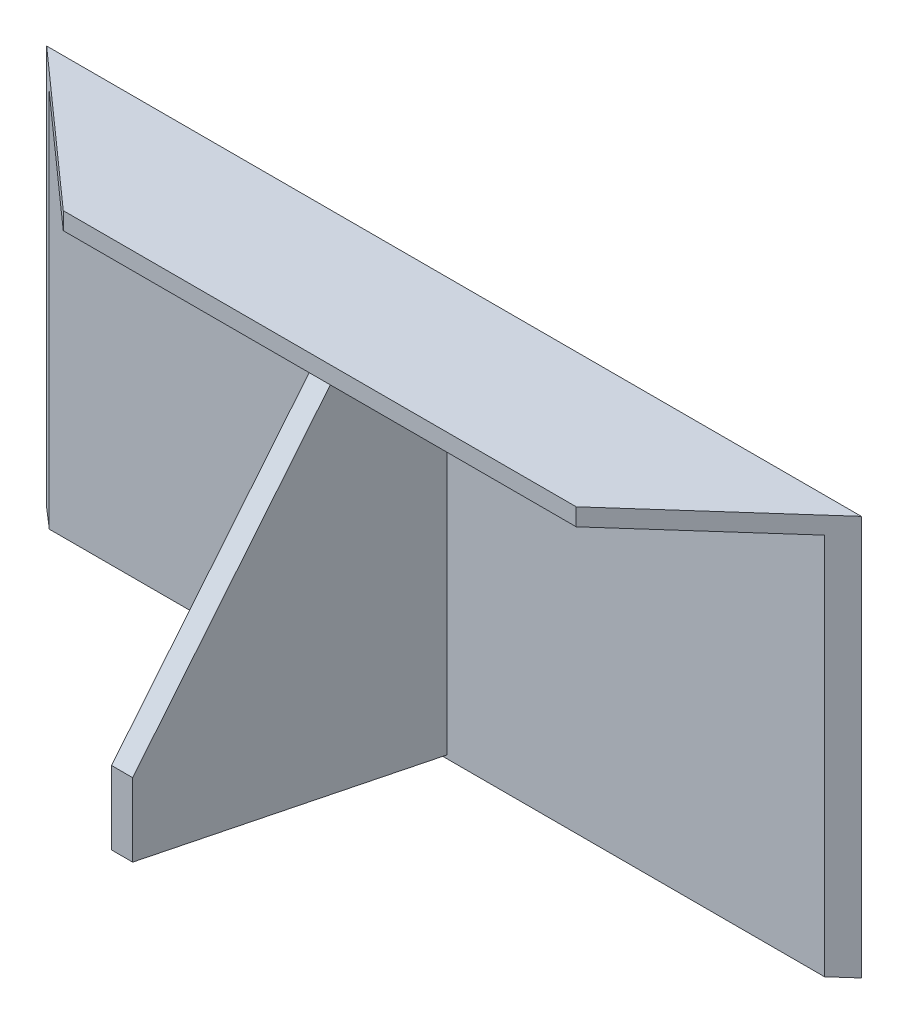
from build123d import *

# Parameters (mm, degrees)
SKETCH_1_W          = 540
SKETCH_1_H          = 265
SKETCH_1_R          = 13
EXTRUDE_635_DEPTH   = 11.5
SKETCH_2_W          = 540
SKETCH_2_H          = 11.5
EXTRUDE_1_DEPTH     = 77.5
CUT_EXTRUDE_1_DEPTH = 609.067430471
SKETCH_4_R          = 13
CUT_EXTRUDE_2_DEPTH = 609.067430471
SKETCH_5_W          = 14
SKETCH_5_H          = 253.5
EXTRUDE_2_DEPTH     = 208.5
SKETCH_6_R          = 13
CUT_EXTRUDE_3_DEPTH = 442.988687638
EXTRUDE_3_DEPTH     = 14
SKETCH_8_W          = 514.15730337
SKETCH_8_H          = 253.5
EXTRUDE_4_DEPTH     = 11.5
EXTRUDE_5_DEPTH     = 11.5


with BuildPart() as part:
    # 草图1 → Extrude 635 (new body)
    with BuildSketch(Plane.XY):
        with Locations((270, 132.5)):
            Rectangle(SKETCH_1_W, SKETCH_1_H)
        with Locations((97.46594539, 108.46594539)):
            Circle(SKETCH_1_R, mode=Mode.SUBTRACT)
        with Locations((40.897402896, 51.897402896)):
            Circle(SKETCH_1_R, mode=Mode.SUBTRACT)
        with Locations((499.102597104, 51.897402896)):
            Circle(SKETCH_1_R, mode=Mode.SUBTRACT)
        with Locations((402.170987639, 92.261534081)):
            Circle(SKETCH_1_R, mode=Mode.SUBTRACT)
        with Locations((230, 121)):
            Circle(SKETCH_1_R, mode=Mode.SUBTRACT)
        with Locations((230, 41)):
            Circle(SKETCH_1_R, mode=Mode.SUBTRACT)
        with Locations((310, 41)):
            Circle(SKETCH_1_R, mode=Mode.SUBTRACT)
        with Locations((310, 121)):
            Circle(SKETCH_1_R, mode=Mode.SUBTRACT)
        with Locations((137.829012361, 92.261534081)):
            Circle(SKETCH_1_R, mode=Mode.SUBTRACT)
        with Locations((442.53405461, 108.46594539)):
            Circle(SKETCH_1_R, mode=Mode.SUBTRACT)
    extrude(amount=EXTRUDE_635_DEPTH)

    # 草图2 → 凸台-拉伸1 (add)
    with BuildSketch(Plane.XY.offset(11.5)):
        with Locations((270, 259.25)):
            Rectangle(SKETCH_2_W, SKETCH_2_H)
    extrude(amount=EXTRUDE_1_DEPTH)

    # 草图3 → 切除-拉伸1 (cut, through all)
    with BuildSketch(Plane(origin=(0, 265, 0), x_dir=(-1, 0, 0), z_dir=(0, 1, 0))):
        Polygon((0, 0), (-100, 89), (0, 89), align=None)
        Polygon((-540, 0), (-440, 89), (-540, 89), align=None)
    extrude(amount=-CUT_EXTRUDE_1_DEPTH, mode=Mode.SUBTRACT)

    # 草图4 → 切除-拉伸2 (cut, through all)
    with BuildSketch(Plane(origin=(0, 265, 0), x_dir=(-1, 0, 0), z_dir=(0, 1, 0))):
        with Locations((-210, 50)):
            Circle(SKETCH_4_R)
        with Locations((-130, 50)):
            Circle(SKETCH_4_R)
        with Locations((-410, 50)):
            Circle(SKETCH_4_R)
        with Locations((-330, 50)):
            Circle(SKETCH_4_R)
    extrude(amount=-CUT_EXTRUDE_2_DEPTH, mode=Mode.SUBTRACT)

    # 草图5 → 凸台-拉伸2 (add)
    with BuildSketch(Plane.XY.offset(11.5)):
        with Locations((270, 126.75)):
            Rectangle(SKETCH_5_W, SKETCH_5_H)
    extrude(amount=EXTRUDE_2_DEPTH)

    # 草图6 → 切除-拉伸3 (cut, through all)
    with BuildSketch(Plane(origin=(277, 0, 0), x_dir=(0, 0, -1), z_dir=(1, 0, 0))):
        with Locations((-115.676148082, 138.142814541)):
            Circle(SKETCH_6_R)
        with Locations((-175.462621788, 84.986652509)):
            Circle(SKETCH_6_R)
        with Locations((-68.377294113, 126.911974174)):
            Circle(SKETCH_6_R)
        Polygon((-89, 253.5), (-220, 93.5), (-220, 253.5), align=None)
        Polygon((-220, 45), (0, 0), (-220, 0), align=None)
    extrude(amount=-CUT_EXTRUDE_3_DEPTH, mode=Mode.SUBTRACT)

    # 草图7 → 凸台-拉伸3 (add)
    with BuildSketch(Plane(origin=(277, 0, 0), x_dir=(0, 0, -1), z_dir=(1, 0, 0))):
        Polygon((-220, 93.5), (-220, 45), (-11.5, 2.352272727), (-11.5, 253.5), (-89, 253.5), align=None)
    extrude(amount=-EXTRUDE_3_DEPTH)

    # 草图8 → 凸台-拉伸4 (add)
    with BuildSketch(Plane.XY.offset(11.5)):
        with Locations((270, 126.75)):
            Rectangle(SKETCH_8_W, SKETCH_8_H)
    extrude(amount=-EXTRUDE_4_DEPTH)

    # 草图9 → 凸台-拉伸5 (add)
    with BuildSketch(Plane(origin=(0, 265, 0), x_dir=(1, 0, 0), z_dir=(0, 1, 0))):
        Polygon((0, 0), (100, -89), (440, -89), (540, 0), align=None)
    extrude(amount=-EXTRUDE_5_DEPTH)


solid = part.part
